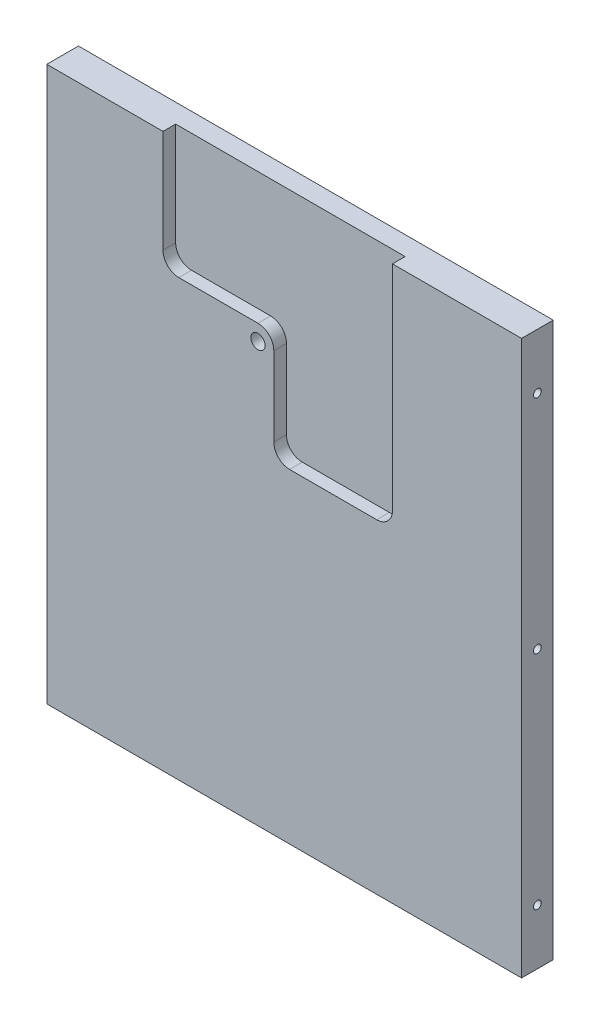
from build123d import *

# Parameters (mm, degrees)
SKIZZE1_W                       = 150
SKIZZE1_H                       = 175
AUFSATZ_LINEAR_AUSTRAGEN1_DEPTH = 10
SKIZZE2_R                       = 2.25
SCHNITT_LINEAR_AUSTRAGEN1_DEPTH = 10
SCHNITT_LINEAR_AUSTRAGEN2_DEPTH = 4
SKIZZE4_R                       = 1.23
SCHNITT_LINEAR_AUSTRAGEN3_DEPTH = 5
SCHNITT_LINEAR_START            = -5
SKIZZE6_R                       = 1.23
SCHNITT_LINEAR_AUSTRAGEN4_DEPTH = 5


with BuildPart() as part:
    # Skizze1 → Aufsatz-Linear austragen1 (new body)
    with BuildSketch(Plane.XY):
        with Locations((-21.140947697, -18.099765847)):
            Rectangle(SKIZZE1_W, SKIZZE1_H)
    extrude(amount=AUFSATZ_LINEAR_AUSTRAGEN1_DEPTH)

    # Skizze2 → Schnitt-Linear austragen1 (cut)
    with BuildSketch(Plane.XY.offset(10)):
        with Locations((-29.425704113, 26.900234153)):
            Circle(SKIZZE2_R)
    extrude(amount=-SCHNITT_LINEAR_AUSTRAGEN1_DEPTH, mode=Mode.SUBTRACT)

    # Skizze3 → Schnitt-Linear austragen2 (cut)
    with BuildSketch(Plane.XY.offset(10)):
        with BuildLine():
            Line((-54.425704113, 31.900234153), (-29.425704113, 31.900234153))
            ThreePointArc((-29.425704113, 31.900234153), (-25.890170208, 30.435768059), (-24.425704113, 26.900234153))
            Line((-24.425704113, 26.900234153), (-24.425704113, 1.900234153))
            ThreePointArc((-24.425704113, 1.900234153), (-22.961238019, -1.635299753), (-19.425704113, -3.099765847))
            Line((-19.425704113, -3.099765847), (8.074295887, -3.099765847))
            ThreePointArc((8.074295887, -3.099765847), (11.609829792, -1.635299753), (13.074295887, 1.900234153))
            Line((13.074295887, 1.900234153), (13.074295887, 69.400234153))
            Line((13.074295887, 69.400234153), (-59.425704113, 69.400234153))
            Line((-59.425704113, 69.400234153), (-59.425704113, 36.900234153))
            ThreePointArc((-59.425704113, 36.900234153), (-57.961238019, 33.364700247), (-54.425704113, 31.900234153))
        make_face()
    extrude(amount=-SCHNITT_LINEAR_AUSTRAGEN2_DEPTH, mode=Mode.SUBTRACT)

    # Skizze4 → Schnitt-Linear austragen3 (cut)
    with BuildSketch(Plane.ZY.offset(96.140947697)):
        with Locations((5, 51.900234153)):
            Circle(SKIZZE4_R)
        with Locations((5, -18.099765847)):
            Circle(SKIZZE4_R)
        with Locations((5, -88.099765847)):
            Circle(SKIZZE4_R)
    extrude(amount=-SCHNITT_LINEAR_AUSTRAGEN3_DEPTH, mode=Mode.SUBTRACT)

    # Skizze6 → Schnitt-Linear austragen4 (cut)
    with BuildSketch(Plane(origin=(53.859052303, 0, 0), x_dir=(0, 0, -1), z_dir=(1, 0, 0)).offset(SCHNITT_LINEAR_START)):
        with Locations((-5, 51.900234153)):
            Circle(SKIZZE6_R)
        with Locations((-5, -18.099765847)):
            Circle(SKIZZE6_R)
        with Locations((-5, -88.099765847)):
            Circle(SKIZZE6_R)
    extrude(amount=SCHNITT_LINEAR_AUSTRAGEN4_DEPTH, mode=Mode.SUBTRACT)


solid = part.part
